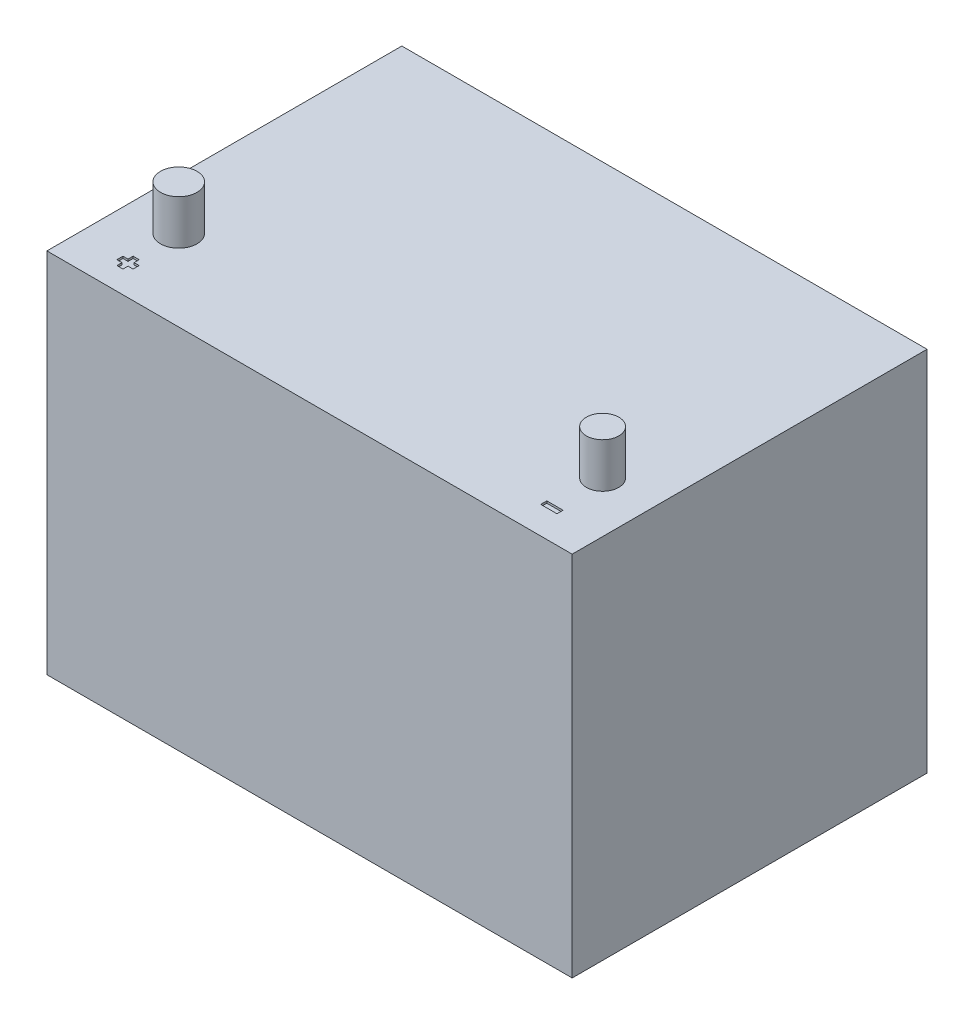
from build123d import *

# Parameters (mm, degrees)
SKETCH1_W           = 259
SKETCH1_H           = 175
BOSS_EXTRUDE1_DEPTH = 181
SKETCH2_R           = 9
SKETCH2_R_2         = 8
BOSS_EXTRUDE2_DEPTH = 22
SKETCH3_W           = 8
SKETCH3_H           = 3
CUT_EXTRUDE1_DEPTH  = 1


with BuildPart() as part:
    # Sketch1 → Boss-Extrude1 (new body)
    with BuildSketch(Plane(origin=(0, 0, 0), x_dir=(1, 0, 0), z_dir=(0, 1, 0))):
        Rectangle(SKETCH1_W, SKETCH1_H)
    extrude(amount=BOSS_EXTRUDE1_DEPTH)

    # Sketch2 → Boss-Extrude2 (add)
    with BuildSketch(Plane(origin=(0, 181, 0), x_dir=(1, 0, 0), z_dir=(0, 1, 0))):
        with Locations((-104.5, -47.5)):
            Circle(SKETCH2_R)
        with Locations((104.5, -47.5)):
            Circle(SKETCH2_R_2)
    extrude(amount=BOSS_EXTRUDE2_DEPTH)

    # Sketch3 → Cut-Extrude1 (cut)
    with BuildSketch(Plane(origin=(0, 181, 0), x_dir=(1, 0, 0), z_dir=(0, 1, 0))):
        Polygon((-103, -68.5), (-106, -68.5), (-106, -71), (-108.5, -71), (-108.5, -74), (-106, -74), (-106, -76.5), (-103, -76.5), (-103, -74), (-100.5, -74), (-100.5, -71), (-103, -71), align=None)
        with Locations((104.5, -72.5)):
            Rectangle(SKETCH3_W, SKETCH3_H)
    extrude(amount=-CUT_EXTRUDE1_DEPTH, mode=Mode.SUBTRACT)


solid = part.part
